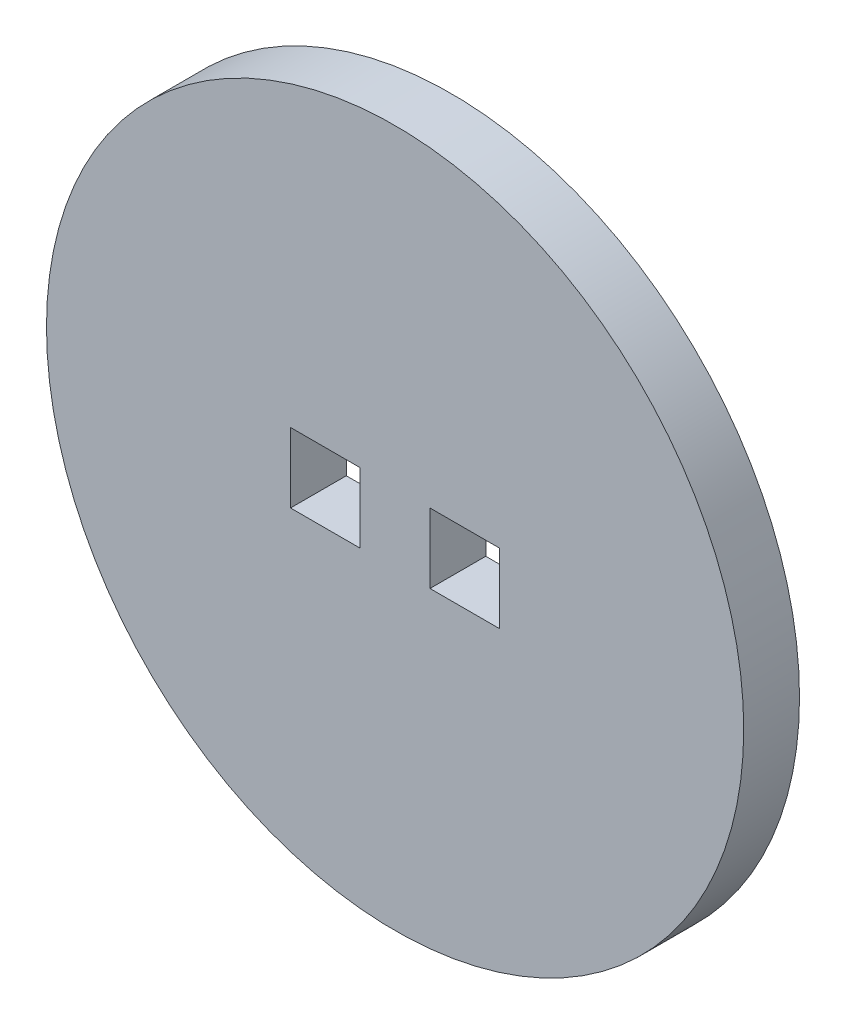
from build123d import *

# Parameters (mm, degrees)
SKETCH1_R           = 15.875
SKETCH1_W           = 3.175
SKETCH1_H           = 3.175
BOSS_EXTRUDE1_DEPTH = 2.54


with BuildPart() as part:
    # Sketch1 → Boss-Extrude1 (new body)
    with BuildSketch(Plane.XY):
        Circle(SKETCH1_R)
        with Locations((-3.175, 0)):
            Rectangle(SKETCH1_W, SKETCH1_H, mode=Mode.SUBTRACT)
        with Locations((3.175, 0)):
            Rectangle(SKETCH1_W, SKETCH1_H, mode=Mode.SUBTRACT)
    extrude(amount=BOSS_EXTRUDE1_DEPTH)


solid = part.part
